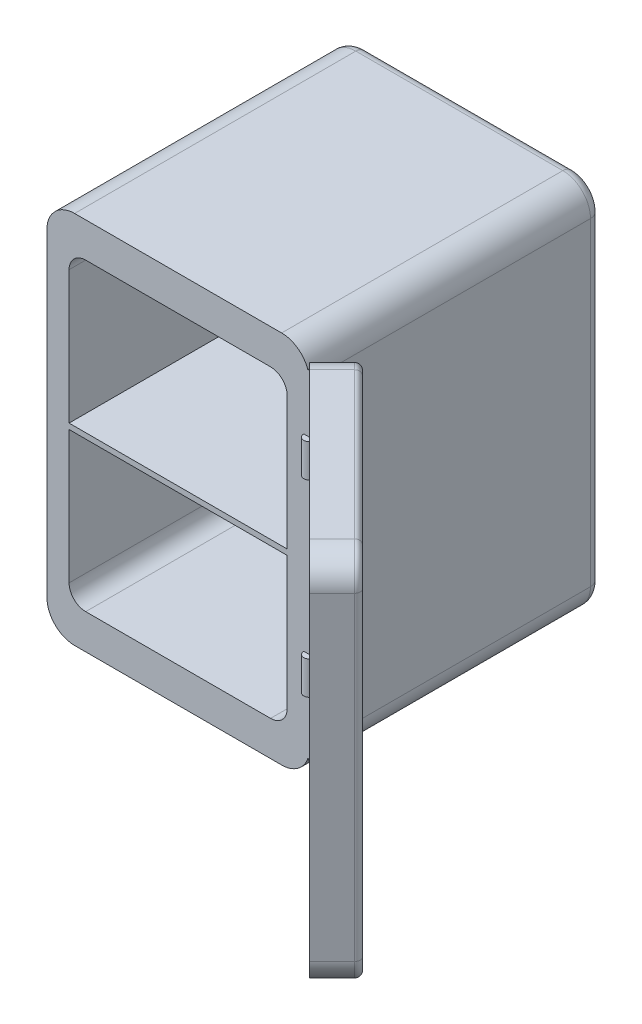
from build123d import *

# Parameters (mm, degrees)
SKETCH_1_W          = 237
SKETCH_1_H          = 338
EXTRUDE_1_DEPTH     = 264
SKETCH_2_W          = 197
SKETCH_2_H          = 275
CUT_EXTRUDE_1_DEPTH = 248
SKETCH_3_W          = 237
SKETCH_3_H          = 5
EXTRUDE_2_DEPTH     = 255
EXTRUDE_START       = 70
SKETCH_4_R          = 5
EXTRUDE_3_DEPTH     = 30
SKETCH_6_W          = 338
SKETCH_6_H          = 237
EXTRUDE_6_DEPTH     = 34
FILLET_1_R          = 25
FILLET_2_R          = 10
FILLET_3_R          = 5
FILLET_4_R          = 15
FILLET_5_R          = 15


with BuildPart() as part:
    # 草图1 → 凸台-拉伸1 (new body)
    with BuildSketch(Plane.XY):
        Rectangle(SKETCH_1_W, SKETCH_1_H)
    extrude(amount=-EXTRUDE_1_DEPTH)

    # 草图2 → 切除-拉伸1 (cut)
    with BuildSketch(Plane.XY):
        Rectangle(SKETCH_2_W, SKETCH_2_H)
    extrude(amount=-CUT_EXTRUDE_1_DEPTH, mode=Mode.SUBTRACT)

    # 草图3 → 凸台-拉伸2 (add)
    with BuildSketch(Plane.XY):
        Rectangle(SKETCH_3_W, SKETCH_3_H)
    extrude(amount=-EXTRUDE_2_DEPTH)

    # 草图4 → 凸台-拉伸3 (add)
    with BuildSketch(Plane(origin=(0, 0, 0), x_dir=(1, 0, 0), z_dir=(0, 1, 0)).offset(EXTRUDE_START)):
        with Locations((118.5, 0)):
            Circle(SKETCH_4_R)
    extrude_3 = extrude(amount=EXTRUDE_3_DEPTH)

    # 镜向1: 凸台-拉伸3 across plane
    add(extrude_3.mirror(Plane.ZX))

    # 草图6 → 凸台-拉伸6 (add)
    with BuildSketch(Plane(origin=(59.25, 0, -59.25), x_dir=(0, 1, 0), z_dir=(-0.7071067811865438, 0, 0.7071067811865512))):
        with Locations((0, -200.292153571)):
            Rectangle(SKETCH_6_W, SKETCH_6_H)
    extrude(amount=-EXTRUDE_6_DEPTH)

    # 圆角1
    # the kernel refuses this fillet: 25 mm, written as the material it takes off along each edge
    with BuildSketch(Plane(origin=(118.5, -169, 59.671572875), x_dir=(-1, 0, 0), z_dir=(0, 0, -1))) as fillet_1_piece_1_section:
        with BuildLine():
            CenterArc((FILLET_1_R, FILLET_1_R), FILLET_1_R, 180, 90)
            Line((0, FILLET_1_R), (-FILLET_1_R * 0.02, FILLET_1_R))
            Line((-FILLET_1_R * 0.02, FILLET_1_R), (-FILLET_1_R * 0.02, -FILLET_1_R * 0.02))
            Line((-FILLET_1_R * 0.02, -FILLET_1_R * 0.02), (FILLET_1_R, -FILLET_1_R * 0.02))
            Line((FILLET_1_R, -FILLET_1_R * 0.02), (FILLET_1_R, 0))
        make_face()
    fillet_1_piece_1 = extrude(amount=323.671572875, mode=Mode.PRIVATE)
    fillet_1_piece_1 = split(fillet_1_piece_1, bisect_by=Plane(origin=(179.466338067, -163.404434067, -63.794765192), z_dir=(-0.7071067811865512, 0, -0.7071067811865438)), keep=Keep.TOP, mode=Mode.PRIVATE)
    add(fillet_1_piece_1, mode=Mode.SUBTRACT)
    with BuildSketch(Plane(origin=(-118.5, -169, 0), x_dir=(1, 0, 0), z_dir=(0, 0, -1)), Plane(origin=(-118.5, 169, 0), x_dir=(0, -1, 0), z_dir=(0, 0, -1))) as fillet_1_piece_2:
        with BuildLine():
            CenterArc((FILLET_1_R, -FILLET_1_R), FILLET_1_R, 90, 90)
            Line((0, -FILLET_1_R), (-FILLET_1_R * 0.02, -FILLET_1_R))
            Line((-FILLET_1_R * 0.02, -FILLET_1_R), (-FILLET_1_R * 0.02, FILLET_1_R * 0.02))
            Line((-FILLET_1_R * 0.02, FILLET_1_R * 0.02), (FILLET_1_R, FILLET_1_R * 0.02))
            Line((FILLET_1_R, FILLET_1_R * 0.02), (FILLET_1_R, 0))
        make_face()
    extrude(amount=264, mode=Mode.SUBTRACT)
    with BuildSketch(Plane(origin=(118.5, 169, 59.671572875), x_dir=(0, -1, 0), z_dir=(0, 0, -1))) as fillet_1_piece_3_section:
        with BuildLine():
            CenterArc((FILLET_1_R, FILLET_1_R), FILLET_1_R, 180, 90)
            Line((0, FILLET_1_R), (-FILLET_1_R * 0.02, FILLET_1_R))
            Line((-FILLET_1_R * 0.02, FILLET_1_R), (-FILLET_1_R * 0.02, -FILLET_1_R * 0.02))
            Line((-FILLET_1_R * 0.02, -FILLET_1_R * 0.02), (FILLET_1_R, -FILLET_1_R * 0.02))
            Line((FILLET_1_R, -FILLET_1_R * 0.02), (FILLET_1_R, 0))
        make_face()
    fillet_1_piece_3 = extrude(amount=323.671572875, mode=Mode.PRIVATE)
    fillet_1_piece_3 = split(fillet_1_piece_3, bisect_by=Plane(origin=(179.466338067, 163.404434067, -63.794765192), z_dir=(-0.7071067811865512, 0, -0.7071067811865438)), keep=Keep.TOP, mode=Mode.PRIVATE)
    add(fillet_1_piece_3, mode=Mode.SUBTRACT)
    with BuildSketch(Plane(origin=(284.670093579, -169, 166.170093579), x_dir=(-0.7071067811865512, -1.1368683772161603e-15, -0.7071067811865439), z_dir=(0.7071067811865438, 0, -0.7071067811865512))) as fillet_1_piece_4:
        with BuildLine():
            CenterArc((FILLET_1_R, FILLET_1_R), FILLET_1_R, 180, 90)
            Line((0, FILLET_1_R), (-FILLET_1_R * 0.02, FILLET_1_R))
            Line((-FILLET_1_R * 0.02, FILLET_1_R), (-FILLET_1_R * 0.02, -FILLET_1_R * 0.02))
            Line((-FILLET_1_R * 0.02, -FILLET_1_R * 0.02), (FILLET_1_R, -FILLET_1_R * 0.02))
            Line((FILLET_1_R, -FILLET_1_R * 0.02), (FILLET_1_R, 0))
        make_face()
    extrude(amount=34, mode=Mode.SUBTRACT)
    with BuildSketch(Plane(origin=(74.305826176, -169, 41.365746699), x_dir=(0.7071067811865512, 0, 0.7071067811865439), z_dir=(0.7071067811865438, 0, -0.7071067811865512))) as fillet_1_piece_5_section:
        with BuildLine():
            CenterArc((FILLET_1_R, -FILLET_1_R), FILLET_1_R, 90, 90)
            Line((0, -FILLET_1_R), (-FILLET_1_R * 0.02, -FILLET_1_R))
            Line((-FILLET_1_R * 0.02, -FILLET_1_R), (-FILLET_1_R * 0.02, FILLET_1_R * 0.02))
            Line((-FILLET_1_R * 0.02, FILLET_1_R * 0.02), (FILLET_1_R, FILLET_1_R * 0.02))
            Line((FILLET_1_R, FILLET_1_R * 0.02), (FILLET_1_R, 0))
        make_face()
    fillet_1_piece_5 = extrude(amount=94.5, mode=Mode.PRIVATE)
    fillet_1_piece_5 = split(fillet_1_piece_5, bisect_by=Plane(origin=(118.5, -163.795791277, -7.320817928), z_dir=(1, 0, 0)), keep=Keep.TOP, mode=Mode.PRIVATE)
    add(fillet_1_piece_5, mode=Mode.SUBTRACT)
    with BuildSketch(Plane(origin=(74.305826176, 169, 41.365746699), x_dir=(0.7071067811865512, 0, 0.7071067811865438), z_dir=(0.7071067811865438, 0, -0.7071067811865512))) as fillet_1_piece_6_section:
        with BuildLine():
            CenterArc((FILLET_1_R, FILLET_1_R), FILLET_1_R, 180, 90)
            Line((0, FILLET_1_R), (-FILLET_1_R * 0.02, FILLET_1_R))
            Line((-FILLET_1_R * 0.02, FILLET_1_R), (-FILLET_1_R * 0.02, -FILLET_1_R * 0.02))
            Line((-FILLET_1_R * 0.02, -FILLET_1_R * 0.02), (FILLET_1_R, -FILLET_1_R * 0.02))
            Line((FILLET_1_R, -FILLET_1_R * 0.02), (FILLET_1_R, 0))
        make_face()
    fillet_1_piece_6 = extrude(amount=94.5, mode=Mode.PRIVATE)
    fillet_1_piece_6 = split(fillet_1_piece_6, bisect_by=Plane(origin=(118.5, 163.795791277, -7.320817928), z_dir=(1, 0, 0)), keep=Keep.TOP, mode=Mode.PRIVATE)
    add(fillet_1_piece_6, mode=Mode.SUBTRACT)
    with BuildSketch(Plane(origin=(284.670093579, 169, 166.170093579), x_dir=(-0.7071067811865512, -3.4106051316484808e-15, -0.7071067811865439), z_dir=(0.7071067811865438, 0, -0.7071067811865512))) as fillet_1_piece_7:
        with BuildLine():
            CenterArc((FILLET_1_R, -FILLET_1_R), FILLET_1_R, 90, 90)
            Line((0, -FILLET_1_R), (-FILLET_1_R * 0.02, -FILLET_1_R))
            Line((-FILLET_1_R * 0.02, -FILLET_1_R), (-FILLET_1_R * 0.02, FILLET_1_R * 0.02))
            Line((-FILLET_1_R * 0.02, FILLET_1_R * 0.02), (FILLET_1_R, FILLET_1_R * 0.02))
            Line((FILLET_1_R, FILLET_1_R * 0.02), (FILLET_1_R, 0))
        make_face()
    extrude(amount=34, mode=Mode.SUBTRACT)
    with BuildSketch(Plane(origin=(118.5, -169, 59.671572875), x_dir=(-1, 0, 0), z_dir=(0, 0, -1))) as fillet_1_piece_8a_section:
        with BuildLine():
            CenterArc((FILLET_1_R, FILLET_1_R), FILLET_1_R, 180, 90)
            Line((0, FILLET_1_R), (-FILLET_1_R * 0.02, FILLET_1_R))
            Line((-FILLET_1_R * 0.02, FILLET_1_R), (-FILLET_1_R * 0.02, -FILLET_1_R * 0.02))
            Line((-FILLET_1_R * 0.02, -FILLET_1_R * 0.02), (FILLET_1_R, -FILLET_1_R * 0.02))
            Line((FILLET_1_R, -FILLET_1_R * 0.02), (FILLET_1_R, 0))
        make_face()
    fillet_1_piece_8a = extrude(amount=323.671572875, mode=Mode.PRIVATE)
    fillet_1_piece_8a = split(fillet_1_piece_8a, bisect_by=Plane(origin=(99.013375852, -163.038214912, 16.658197024), z_dir=(0.7071067811865512, 0, 0.7071067811865438)), keep=Keep.TOP, mode=Mode.PRIVATE)
    with BuildSketch(Plane(origin=(74.305826176, -169, 41.365746699), x_dir=(0.7071067811865512, 0, 0.7071067811865439), z_dir=(0.7071067811865438, 0, -0.7071067811865512))) as fillet_1_piece_8b_section:
        with BuildLine():
            CenterArc((FILLET_1_R, -FILLET_1_R), FILLET_1_R, 90, 90)
            Line((0, -FILLET_1_R), (-FILLET_1_R * 0.02, -FILLET_1_R))
            Line((-FILLET_1_R * 0.02, -FILLET_1_R), (-FILLET_1_R * 0.02, FILLET_1_R * 0.02))
            Line((-FILLET_1_R * 0.02, FILLET_1_R * 0.02), (FILLET_1_R, FILLET_1_R * 0.02))
            Line((FILLET_1_R, FILLET_1_R * 0.02), (FILLET_1_R, 0))
        make_face()
    fillet_1_piece_8b = extrude(amount=94.5, mode=Mode.PRIVATE)
    fillet_1_piece_8b = split(fillet_1_piece_8b, bisect_by=Plane(origin=(118.5, -163.038214912, 24.729821031), z_dir=(-1, 0, 0)), keep=Keep.TOP, mode=Mode.PRIVATE)
    fillet_1_piece_8 = fillet_1_piece_8a & fillet_1_piece_8b
    add(fillet_1_piece_8, mode=Mode.SUBTRACT)
    with BuildSketch(Plane(origin=(118.5, 169, 59.671572875), x_dir=(0, -1, 0), z_dir=(0, 0, -1))) as fillet_1_piece_9a_section:
        with BuildLine():
            CenterArc((FILLET_1_R, FILLET_1_R), FILLET_1_R, 180, 90)
            Line((0, FILLET_1_R), (-FILLET_1_R * 0.02, FILLET_1_R))
            Line((-FILLET_1_R * 0.02, FILLET_1_R), (-FILLET_1_R * 0.02, -FILLET_1_R * 0.02))
            Line((-FILLET_1_R * 0.02, -FILLET_1_R * 0.02), (FILLET_1_R, -FILLET_1_R * 0.02))
            Line((FILLET_1_R, -FILLET_1_R * 0.02), (FILLET_1_R, 0))
        make_face()
    fillet_1_piece_9a = extrude(amount=323.671572875, mode=Mode.PRIVATE)
    fillet_1_piece_9a = split(fillet_1_piece_9a, bisect_by=Plane(origin=(99.013375852, 163.038214912, 16.658197024), z_dir=(0.7071067811865512, 0, 0.7071067811865438)), keep=Keep.TOP, mode=Mode.PRIVATE)
    with BuildSketch(Plane(origin=(74.305826176, 169, 41.365746699), x_dir=(0.7071067811865512, 0, 0.7071067811865438), z_dir=(0.7071067811865438, 0, -0.7071067811865512))) as fillet_1_piece_9b_section:
        with BuildLine():
            CenterArc((FILLET_1_R, FILLET_1_R), FILLET_1_R, 180, 90)
            Line((0, FILLET_1_R), (-FILLET_1_R * 0.02, FILLET_1_R))
            Line((-FILLET_1_R * 0.02, FILLET_1_R), (-FILLET_1_R * 0.02, -FILLET_1_R * 0.02))
            Line((-FILLET_1_R * 0.02, -FILLET_1_R * 0.02), (FILLET_1_R, -FILLET_1_R * 0.02))
            Line((FILLET_1_R, -FILLET_1_R * 0.02), (FILLET_1_R, 0))
        make_face()
    fillet_1_piece_9b = extrude(amount=94.5, mode=Mode.PRIVATE)
    fillet_1_piece_9b = split(fillet_1_piece_9b, bisect_by=Plane(origin=(118.5, 163.038214912, 24.729821031), z_dir=(-1, 0, 0)), keep=Keep.TOP, mode=Mode.PRIVATE)
    fillet_1_piece_9 = fillet_1_piece_9a & fillet_1_piece_9b
    add(fillet_1_piece_9, mode=Mode.SUBTRACT)

    # 圆角2
    fillet_2_edges = [part.edges().sort_by_distance(p)[0] for p in [
        (0, -169, -264),
        (118.5, 0, -264),
        (-118.5, 0, -264),
        (0, 169, -264),
        (-111.17766953, 161.67766953, -264),
        (111.17766953, 161.67766953, -264),
        (-111.17766953, -161.67766953, -264),
        (111.17766953, -161.67766953, -264),
    ]]
    fillet(fillet_2_edges, radius=FILLET_2_R)

    # 圆角3
    fillet_3_edges = [part.edges().sort_by_distance(p)[0] for p in [
        (224.919570569, -169, 58.336309448),
        (141.127416998, 0, -25.455844123),
        (224.919570569, 169, 58.336309448),
        (308.711724139, 0, 142.128463018),
        (146.305086528, 161.67766953, -20.278174593),
        (303.53405461, 161.67766953, 136.950793489),
        (303.53405461, -161.67766953, 136.950793489),
        (146.305086528, -161.67766953, -20.278174593),
    ]]
    fillet(fillet_3_edges, radius=FILLET_3_R)

    # 圆角4
    fillet_4_edges = [part.edges().sort_by_distance(p)[0] for p in [
        (98.5, -70, -248),
        (98.5, 137.5, -124),
        (0, -137.5, -248),
        (98.5, -137.5, -124),
        (-98.5, -137.5, -124),
        (0, 137.5, -248),
        (-98.5, 137.5, -124),
        (-98.5, -70, -248),
    ]]
    fillet(fillet_4_edges, radius=FILLET_4_R)

    # 圆角5
    # the kernel refuses this fillet: 15 mm, written as the material it adds along each edge
    with BuildSketch(Plane(origin=(-83.5, 122.5, -233), x_dir=(0, 0, -1), z_dir=(-1, 0, 0))) as fillet_5_piece_1_section:
        Polygon((0, 0), (FILLET_5_R * 1.02, 0), (FILLET_5_R * 1.02, -FILLET_5_R * 1.02), (0, -FILLET_5_R * 1.02), align=None)
    fillet_5_piece_1 = extrude(amount=FILLET_5_R * 1.02, mode=Mode.PRIVATE)
    fillet_5_piece_1 = fillet_5_piece_1 - Plane(origin=(-83.5, 122.5, -233), x_dir=(0, -0.7071067811865475, 0.7071067811865475), z_dir=(-1, 0, 0)) * Sphere(FILLET_5_R, mode=Mode.PRIVATE)
    add(fillet_5_piece_1)
    with BuildSketch(Plane(origin=(83.5, 122.5, -233), x_dir=(0, 0, -1), z_dir=(1, 0, 0))) as fillet_5_piece_2_section:
        Polygon((0, 0), (FILLET_5_R * 1.02, 0), (FILLET_5_R * 1.02, FILLET_5_R * 1.02), (0, FILLET_5_R * 1.02), align=None)
    fillet_5_piece_2 = extrude(amount=FILLET_5_R * 1.02, mode=Mode.PRIVATE)
    fillet_5_piece_2 = fillet_5_piece_2 - Plane(origin=(83.5, 122.5, -233), x_dir=(0, -0.7071067811865475, 0.7071067811865475), z_dir=(1, 0, 0)) * Sphere(FILLET_5_R, mode=Mode.PRIVATE)
    add(fillet_5_piece_2)
    with BuildSketch(Plane(origin=(-98.5, -35, -248), x_dir=(0, 0, 1), z_dir=(0, 1, 0)), Plane(origin=(98.5, 122.5, -248), x_dir=(0, 0, 1), z_dir=(0, -1, 0))) as fillet_5_piece_3:
        with BuildLine():
            CenterArc((FILLET_5_R, FILLET_5_R), FILLET_5_R, 180, 90)
            Line((0, FILLET_5_R), (0, 0))
            Line((0, 0), (FILLET_5_R, 0))
        make_face()
    extrude(amount=157.5)


solid = part.part
